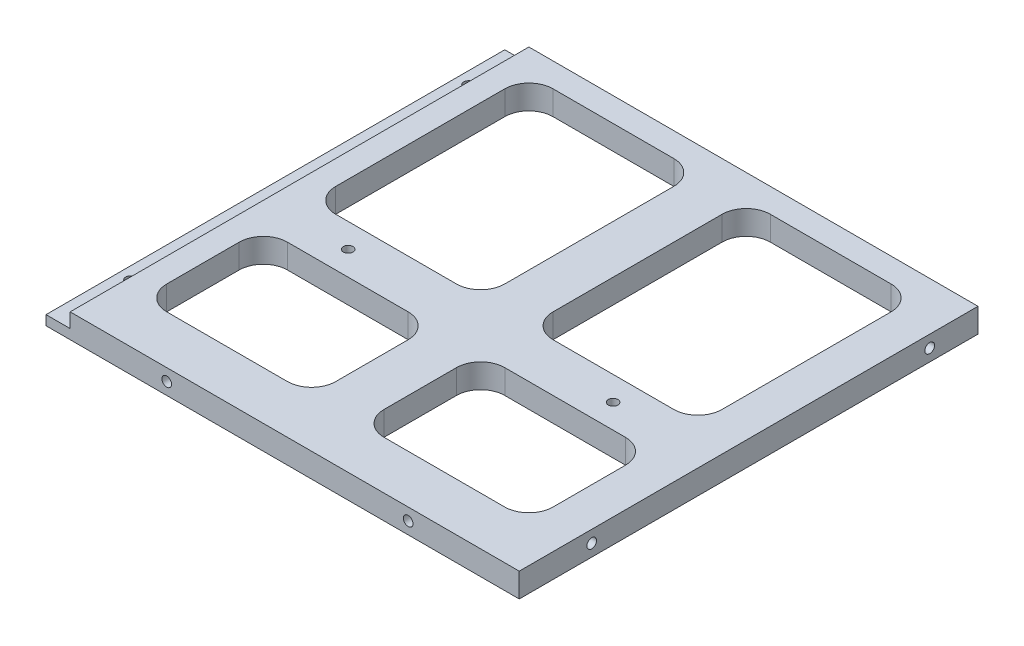
from build123d import *

# Parameters (mm, degrees)
SKETCH1_W                             = 98
SKETCH1_H                             = 95
BOSS_EXTRUDE1_DEPTH                   = 5
SKETCH6_W                             = 5
SKETCH6_H                             = 95
CUT_EXTRUDE1_DEPTH                    = 3
CUT_EXTRUDE2_DEPTH                    = 137.579647093
TAP_DRILL_FOR_M2X0_4_TAP4_D           = 2
TAP_DRILL_FOR_M2X0_4_TAP1_D           = 2
TAP_DRILL_FOR_M2X0_4_TAP1_CSINK_D     = 4.2
TAP_DRILL_FOR_M2X0_4_TAP1_CSINK_ANGLE = 90
TAP_DRILL_FOR_M2X0_4_TAP3_D           = 2
TAP_DRILL_FOR_M2X0_4_TAP3_DEPTH       = 6
TAP_DRILL_FOR_M2X0_4_TAP3_TIP         = 0.600860619
TAP_DRILL_FOR_M2X0_4_TAP5_D           = 2
TAP_DRILL_FOR_M2X0_4_TAP5_DEPTH       = 4
TAP_DRILL_FOR_M2X0_4_TAP5_TIP         = 0.600860619
TAP_DRILL_FOR_M2X0_4_TAP6_D           = 2
TAP_DRILL_FOR_M2X0_4_TAP6_DEPTH       = 7
TAP_DRILL_FOR_M2X0_4_TAP6_TIP         = 0.600860619


with BuildPart() as part:
    # Sketch1 → Boss-Extrude1 (new body)
    with BuildSketch(Plane(origin=(0, 0, 0), x_dir=(1, 0, 0), z_dir=(0, 1, 0))):
        with Locations((49, 47.5)):
            Rectangle(SKETCH1_W, SKETCH1_H)
    extrude(amount=BOSS_EXTRUDE1_DEPTH)

    # Sketch6 → Cut-Extrude1 (cut)
    with BuildSketch(Plane(origin=(0, 5, 0), x_dir=(1, 0, 0), z_dir=(0, 1, 0))):
        with Locations((2.5, 47.5)):
            Rectangle(SKETCH6_W, SKETCH6_H)
    extrude(amount=-CUT_EXTRUDE1_DEPTH, mode=Mode.SUBTRACT)

    # Sketch5 → Cut-Extrude2 (cut, through all)
    with BuildSketch(Plane(origin=(0, 5, 0), x_dir=(1, 0, 0), z_dir=(0, 1, 0))):
        with BuildLine():
            Line((15, 90), (40, 90))
            ThreePointArc((40, 90), (43.535533906, 88.535533906), (45, 85))
            Line((45, 85), (45, 50))
            ThreePointArc((45, 50), (43.535533906, 46.464466094), (40, 45))
            Line((40, 45), (15, 45))
            ThreePointArc((15, 45), (11.464466094, 46.464466094), (10, 50))
            Line((10, 50), (10, 85))
            ThreePointArc((10, 85), (11.464466094, 88.535533906), (15, 90))
        make_face()
        with BuildLine():
            Line((60, 90), (85, 90))
            ThreePointArc((85, 90), (88.535533906, 88.535533906), (90, 85))
            Line((90, 85), (90, 50))
            ThreePointArc((90, 50), (88.535533906, 46.464466094), (85, 45))
            Line((85, 45), (60, 45))
            ThreePointArc((60, 45), (56.464466094, 46.464466094), (55, 50))
            Line((55, 50), (55, 85))
            ThreePointArc((55, 85), (56.464466094, 88.535533906), (60, 90))
        make_face()
        with BuildLine():
            Line((60, 35), (85, 35))
            ThreePointArc((85, 35), (88.535533906, 33.535533906), (90, 30))
            Line((90, 30), (90, 15))
            ThreePointArc((90, 15), (88.535533906, 11.464466094), (85, 10))
            Line((85, 10), (60, 10))
            ThreePointArc((60, 10), (56.464466094, 11.464466094), (55, 15))
            Line((55, 15), (55, 30))
            ThreePointArc((55, 30), (56.464466094, 33.535533906), (60, 35))
        make_face()
        with BuildLine():
            Line((15, 35), (40, 35))
            ThreePointArc((40, 35), (43.535533906, 33.535533906), (45, 30))
            Line((45, 30), (45, 15))
            ThreePointArc((45, 15), (43.535533906, 11.464466094), (40, 10))
            Line((40, 10), (15, 10))
            ThreePointArc((15, 10), (11.464466094, 11.464466094), (10, 15))
            Line((10, 15), (10, 30))
            ThreePointArc((10, 30), (11.464466094, 33.535533906), (15, 35))
        make_face()
    extrude(amount=-CUT_EXTRUDE2_DEPTH, mode=Mode.SUBTRACT)

    # Tap Drill for M2x0.4 Tap4 (through all)
    with Locations(Plane(origin=(22.568, 5, -40), x_dir=(0, 0, 1), z_dir=(0, 1, 0))):
        with Locations((0, 0), (0, 54.864)):
            Hole(TAP_DRILL_FOR_M2X0_4_TAP4_D / 2)

    # Tap Drill for M2x0.4 Tap1 (through all)
    with Locations(Plane(origin=(2.5, 0, -15), x_dir=(0, 0, -1), z_dir=(0, -1, 0))):
        with Locations((0, 0), (70, 0)):
            CounterSinkHole(TAP_DRILL_FOR_M2X0_4_TAP1_D / 2, TAP_DRILL_FOR_M2X0_4_TAP1_CSINK_D / 2, counter_sink_angle=TAP_DRILL_FOR_M2X0_4_TAP1_CSINK_ANGLE)

    # Tap Drill for M2x0.4 Tap3
    with Locations(Plane(origin=(98, 2.5, -15), x_dir=(0, 0, 1), z_dir=(1, 0, 0))):
        with Locations((0, 0), (-70, 0)):
            Hole(TAP_DRILL_FOR_M2X0_4_TAP3_D / 2, depth=TAP_DRILL_FOR_M2X0_4_TAP3_DEPTH)
            with Locations((0, 0, -(TAP_DRILL_FOR_M2X0_4_TAP3_DEPTH + TAP_DRILL_FOR_M2X0_4_TAP3_TIP / 2))):  # 118° drill point
                Cone(0, TAP_DRILL_FOR_M2X0_4_TAP3_D / 2, TAP_DRILL_FOR_M2X0_4_TAP3_TIP, mode=Mode.SUBTRACT)

    # Tap Drill for M2x0.4 Tap5
    with Locations(Plane(origin=(92.75, 2.5, -95), x_dir=(-1, 0, 0), z_dir=(0, 0, -1))):
        with Locations((0, 0), (85.5, 0)):
            Hole(TAP_DRILL_FOR_M2X0_4_TAP5_D / 2, depth=TAP_DRILL_FOR_M2X0_4_TAP5_DEPTH)
            with Locations((0, 0, -(TAP_DRILL_FOR_M2X0_4_TAP5_DEPTH + TAP_DRILL_FOR_M2X0_4_TAP5_TIP / 2))):  # 118° drill point
                Cone(0, TAP_DRILL_FOR_M2X0_4_TAP5_D / 2, TAP_DRILL_FOR_M2X0_4_TAP5_TIP, mode=Mode.SUBTRACT)

    # Tap Drill for M2x0.4 Tap6
    with Locations(Plane(origin=(25, 2.5, 0), x_dir=(1, 0, 0), z_dir=(0, 0, 1))):
        with Locations((0, 0), (50, 0)):
            Hole(TAP_DRILL_FOR_M2X0_4_TAP6_D / 2, depth=TAP_DRILL_FOR_M2X0_4_TAP6_DEPTH)
            with Locations((0, 0, -(TAP_DRILL_FOR_M2X0_4_TAP6_DEPTH + TAP_DRILL_FOR_M2X0_4_TAP6_TIP / 2))):  # 118° drill point
                Cone(0, TAP_DRILL_FOR_M2X0_4_TAP6_D / 2, TAP_DRILL_FOR_M2X0_4_TAP6_TIP, mode=Mode.SUBTRACT)


solid = part.part
